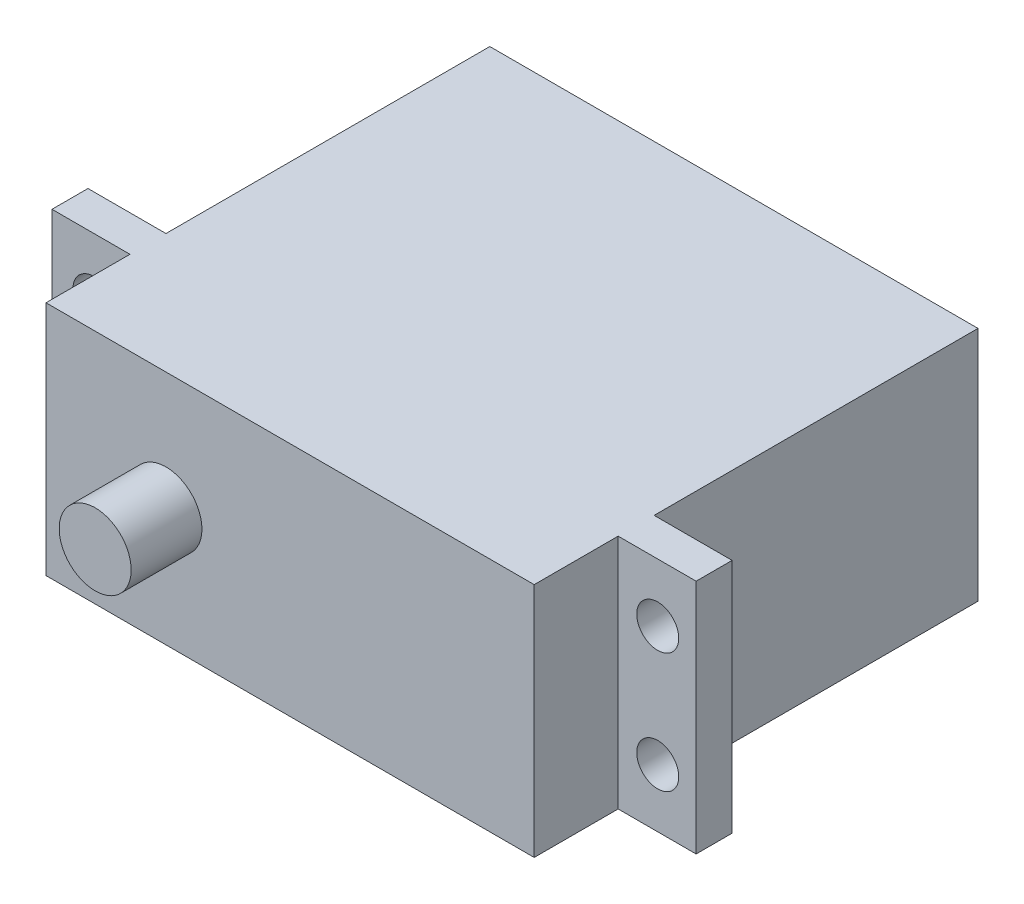
from build123d import *

# Parameters (mm, degrees)
CASE_40P7X19P7_START                 = -30
CASE_40P7X19P7_PROFILE_W             = 40.7
CASE_40P7X19P7_PROFILE_H             = 19.7
CASE_40P7X19P7_DEPTH                 = 37
MOUNTING_FLANGE_NOMINAL_START        = -3
MOUNTING_FLANGE_NOMINAL_PROFILE_W    = 53.7
MOUNTING_FLANGE_NOMINAL_PROFILE_H    = 19.7
MOUNTING_FLANGE_NOMINAL_DEPTH        = 3
OUTPUT_ENVELOPE_NOT_SPLINE_START     = 7
OUTPUT_ENVELOPE_NOT_SPLINE_PROFILE_R = 3
OUTPUT_ENVELOPE_NOT_SPLINE_DEPTH     = 5.9
TAB_HOLES_NOMINAL_START              = -50
TAB_HOLES_NOMINAL_PROFILE_R          = 1.75
TAB_HOLES_NOMINAL_DEPTH              = 99.794082633


with BuildPart() as part:
    # Case_40p7x19p7_profile → Case_40p7x19p7 (new body)
    with BuildSketch(Plane.XY.offset(CASE_40P7X19P7_START)):
        with Locations((10.35, 0)):
            Rectangle(CASE_40P7X19P7_PROFILE_W, CASE_40P7X19P7_PROFILE_H)
    extrude(amount=CASE_40P7X19P7_DEPTH)

    # Mounting_flange_nominal_profile → Mounting_flange_nominal (add)
    with BuildSketch(Plane.XY.offset(MOUNTING_FLANGE_NOMINAL_START)):
        with Locations((10.35, 0)):
            Rectangle(MOUNTING_FLANGE_NOMINAL_PROFILE_W, MOUNTING_FLANGE_NOMINAL_PROFILE_H)
    extrude(amount=MOUNTING_FLANGE_NOMINAL_DEPTH)

    # Output_envelope_not_spline_profile → Output_envelope_not_spline (add)
    with BuildSketch(Plane.XY.offset(OUTPUT_ENVELOPE_NOT_SPLINE_START)):
        Circle(OUTPUT_ENVELOPE_NOT_SPLINE_PROFILE_R)
    extrude(amount=OUTPUT_ENVELOPE_NOT_SPLINE_DEPTH)

    # Tab_holes_nominal_profile → Tab_holes_nominal (cut, through all)
    with BuildSketch(Plane.XY.offset(TAB_HOLES_NOMINAL_START)):
        with Locations((-13, 5)):
            Circle(TAB_HOLES_NOMINAL_PROFILE_R)
        with Locations((-13, -5)):
            Circle(TAB_HOLES_NOMINAL_PROFILE_R)
        with Locations((34, 5)):
            Circle(TAB_HOLES_NOMINAL_PROFILE_R)
        with Locations((34, -5)):
            Circle(TAB_HOLES_NOMINAL_PROFILE_R)
    extrude(amount=TAB_HOLES_NOMINAL_DEPTH, mode=Mode.SUBTRACT)


solid = part.part
